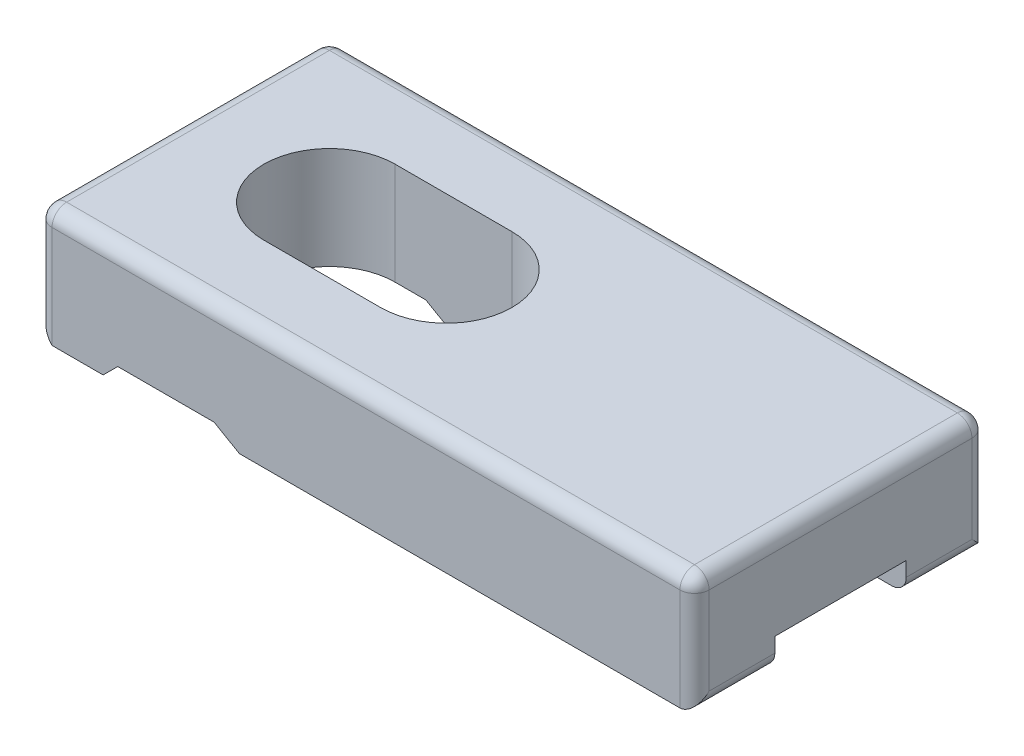
from build123d import *
from OCP.BRepFilletAPI import BRepFilletAPI_MakeChamfer

# Parameters (mm, degrees)
SKETCH_1_W          = 45
SKETCH_1_H          = 20
EXTRUDE_1_DEPTH     = 8
CUT_EXTRUDE_1_DEPTH = 2
CUT_EXTRUDE_2_DEPTH = 1
CHAMFER_1_SIZE      = 1
CHAMFER_2_SIZE      = 1
CHAMFER_2_SIZE_2    = 1.732050808
FILLET_1_R          = 1


with BuildPart() as part:
    # 草图1 → 凸台-拉伸1 (new body)
    with BuildSketch(Plane(origin=(0, 0, 0), x_dir=(1, 0, 0), z_dir=(0, 1, 0))):
        with Locations((22.5, 10)):
            Rectangle(SKETCH_1_W, SKETCH_1_H)
        with BuildLine():
            Line((18, 5.5), (10, 5.5))
            ThreePointArc((10, 5.5), (5.5, 10), (10, 14.5))
            Line((10, 14.5), (18, 14.5))
            ThreePointArc((18, 14.5), (22.5, 10), (18, 5.5))
        make_face(mode=Mode.SUBTRACT)
    extrude(amount=EXTRUDE_1_DEPTH)

    # 草图2 → 切除-拉伸1 (cut)
    with BuildSketch(Plane.XZ):
        with BuildLine():
            Line((45, -5.5), (45, -14.5))
            Line((45, -14.5), (10, -14.5))
            ThreePointArc((10, -14.5), (5.5, -10), (10, -5.5))
            Line((10, -5.5), (45, -5.5))
        make_face()
    extrude(amount=-CUT_EXTRUDE_1_DEPTH, mode=Mode.SUBTRACT)

    # 草图3 → 切除-拉伸2 (cut)
    with BuildSketch(Plane.XZ):
        Polygon((0, -5.5), (5.5, -5.5), (5.5, 0), (12.1, 0), (12.1, -20), (5.5, -20), (5.5, -14.5), (0, -14.5), align=None)
    extrude(amount=-CUT_EXTRUDE_2_DEPTH, mode=Mode.SUBTRACT)

    # 倒角1
    chamfer_1_edges = [part.edges().sort_by_distance(p)[0] for p in [
        (0, 0, -17.25),
        (5.5, 0, -17.25),
        (5.5, 0, -2.75),
        (0, 0, -2.75),
    ]]
    chamfer(chamfer_1_edges, length=CHAMFER_1_SIZE - 0.0001)  # a hair under: the kernel refuses the full size

    # 倒角2
    chamfer_2_edges_1 = [part.edges().sort_by_distance(p)[0] for p in [
        (12.1, 0, -17.25),
    ]]
    chamfer_2_side_1 = [part.faces().sort_by_distance(p)[0] for p in [
        (12.1, 0.02, -17.25),
    ]]
    chamfer_2_edges_2 = [part.edges().sort_by_distance(p)[0] for p in [
        (12.1, 0, -2.75),
    ]]
    chamfer_2_side_2 = [part.faces().sort_by_distance(p)[0] for p in [
        (12.1, 0.02, -2.75),
    ]]
    chamfer_2 = BRepFilletAPI_MakeChamfer(part.part.solid().wrapped)
    for e in chamfer_2_edges_1:
        chamfer_2.Add(CHAMFER_2_SIZE - 0.0001, CHAMFER_2_SIZE_2 - 0.0001, e.wrapped, chamfer_2_side_1[0].wrapped)
    for e in chamfer_2_edges_2:
        chamfer_2.Add(CHAMFER_2_SIZE - 0.0001, CHAMFER_2_SIZE_2 - 0.0001, e.wrapped, chamfer_2_side_2[0].wrapped)
    add(Compound.cast(chamfer_2.Shape()), mode=Mode.REPLACE)  # a hair under: the kernel refuses the full size

    # 圆角1
    fillet_1_edges = [part.edges().sort_by_distance(p)[0] for p in [
        (22.5, 8, -20),
        (45, 8, -10),
        (22.5, 8, 0),
        (0, 8, -10),
        (45, 4, 0),
        (45, 4, -20),
        (0, 4.49995, -20),
        (0, 4.49995, 0),
        (45, 0, -17.25),
        (45, 0, -2.75),
    ]]
    fillet(fillet_1_edges, radius=FILLET_1_R)


solid = part.part
